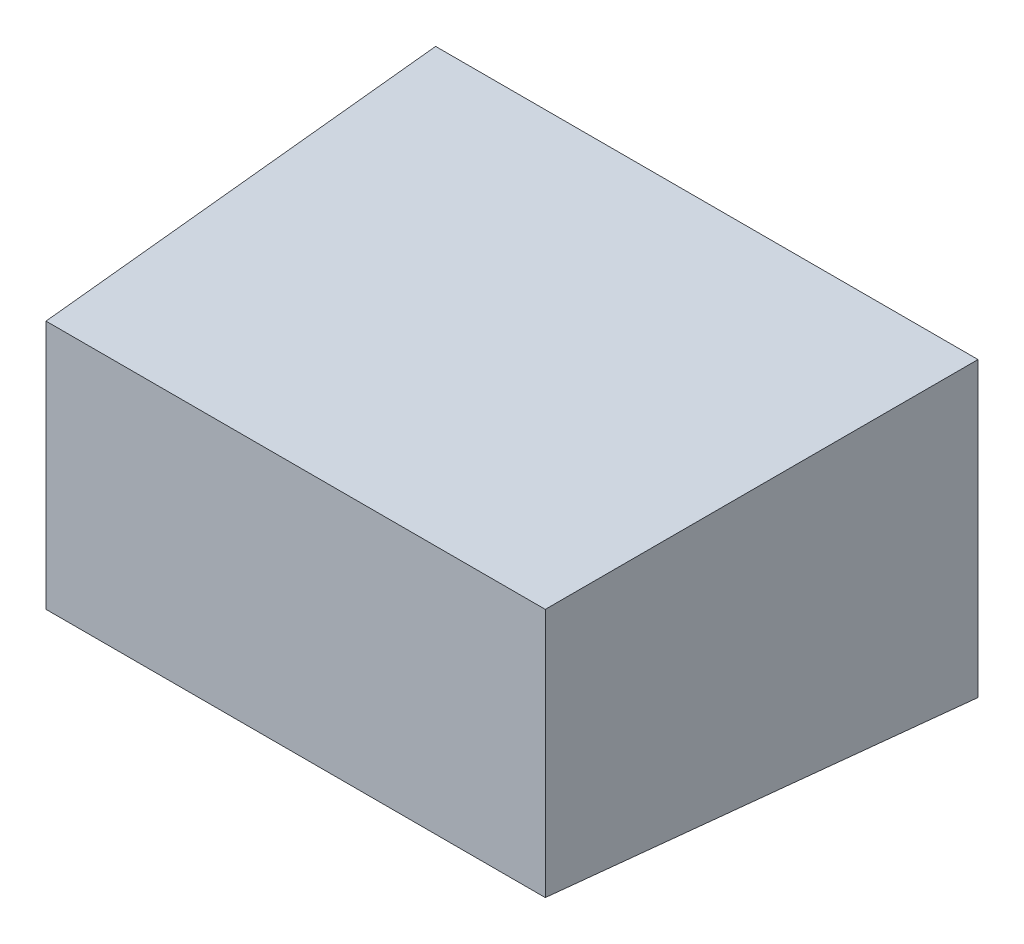
from build123d import *

# Parameters (mm, degrees)
SKETCH1_W           = 190
SKETCH1_H           = 105
BOSS_EXTRUDE1_DEPTH = 140
CHAMFER1_SIZE       = 190.811366877
CHAMFER1_SIZE_2     = 10
SHELL1_T            = -3


with BuildPart() as part:
    # Sketch1 → Boss-Extrude1 (new body)
    with BuildSketch(Plane.XY):
        with Locations((-15.339943343, 4.194995279)):
            Rectangle(SKETCH1_W, SKETCH1_H)
    extrude(amount=BOSS_EXTRUDE1_DEPTH)

    # Chamfer1
    # the kernel refuses this chamfer: 190.811366877, 10 mm, written as the material it takes off along each edge
    with BuildSketch(Plane(origin=(-606.424352322, 56.694995279, 140), x_dir=(0, 0.00201302342238207, -0.9999979738662977), z_dir=(1, 0, 0)), Plane(origin=(575.744465637, -48.305004721, 140), x_dir=(0, -0.00201302342238207, -0.9999979738662977), z_dir=(-1, 0, 0))) as chamfer1_piece_1:
        Polygon((CHAMFER1_SIZE * 0.999997973868, -CHAMFER1_SIZE * 0.00201302342239), (-CHAMFER1_SIZE_2 * 0.00201302342238, -CHAMFER1_SIZE_2 * 0.999997973866), (0, 0), align=None)
    extrude(amount=1182.168817959, mode=Mode.SUBTRACT)
    with BuildSketch(Plane(origin=(79.660056657, 552.779404258, 140), x_dir=(0.0020130234223821055, 0, -0.9999979738662977), z_dir=(0, -1, 0)), Plane(origin=(-110.339943343, -544.389413701, 140), x_dir=(-0.0020130234223821055, 0, -0.9999979738662977), z_dir=(0, 1, 0))) as chamfer1_piece_2:
        Polygon((CHAMFER1_SIZE * 0.999997973868, -CHAMFER1_SIZE * 0.00201302342239), (-CHAMFER1_SIZE_2 * 0.00201302342238, -CHAMFER1_SIZE_2 * 0.999997973866), (0, 0), align=None)
    extrude(amount=1097.168817959, mode=Mode.SUBTRACT)

    # Shell1
    shell1_openings = [part.faces().sort_by_distance(p)[0] for p in [
        (-15.339943343, 4.194995279, 0),
    ]]
    offset(amount=SHELL1_T, openings=shell1_openings, kind=Kind.INTERSECTION)


solid = part.part
